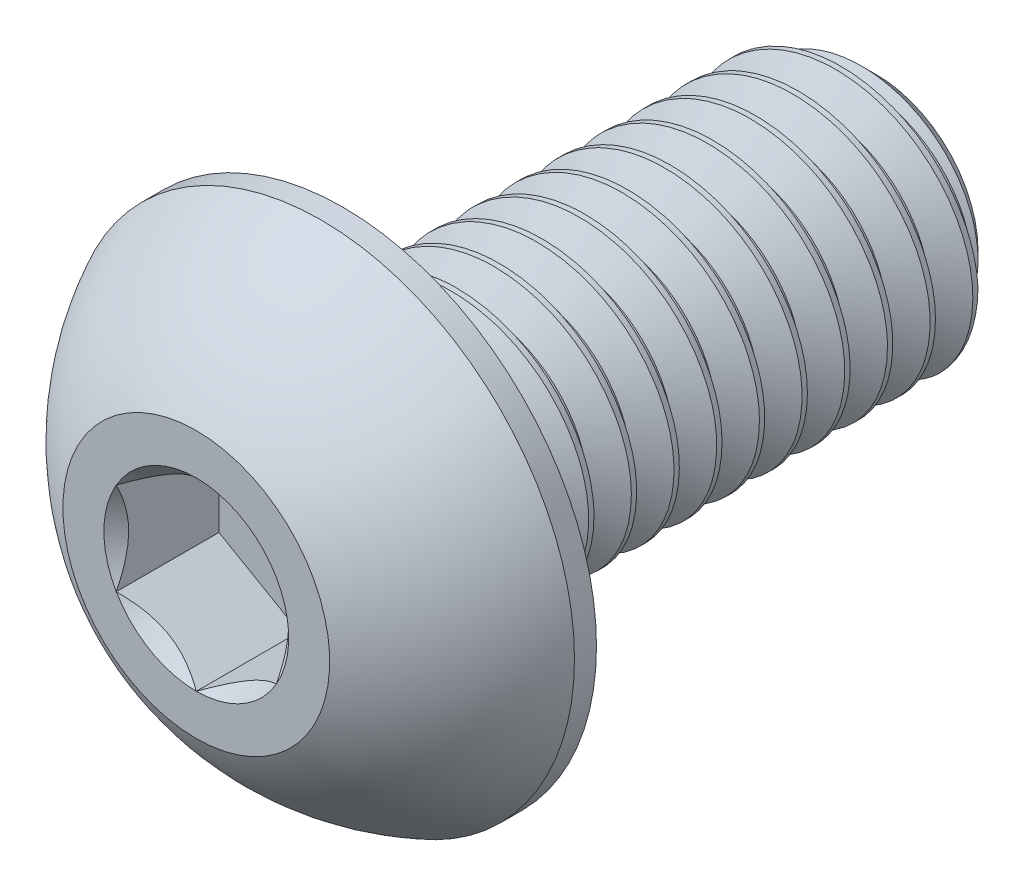
from build123d import *

# Parameters (mm, degrees)
CUT_EXTRUDE2_DEPTH = 1.925
CUT_SWEEP2_PITCH   = 0.8
CUT_SWEEP2_TO      = 10


with BuildPart() as part:
    # Sketch10 → Revolve3 (revolve)
    with BuildSketch(Plane(origin=(0, 0, 0), x_dir=(0, 0, -1), z_dir=(1, 0, 0)), mode=Mode.PRIVATE) as revolve3_sk:
        Polygon((12.15, 2.5), (12.75, 1.9), (12.75, 0), (2.75, 0), (2.75, 2.5), align=None)
    revolve(revolve3_sk.sketch.rotate(Axis((0, 0, 0), (0, 0, -1)), 90), axis=Axis((0, 0, 0), (0, 0, -1)))

    # Sketch7 → Revolve2 (revolve)
    with BuildSketch(Plane(origin=(0, 0, 0), x_dir=(0, 0, -1), z_dir=(1, 0, 0)), mode=Mode.PRIVATE) as revolve2_sk:
        with BuildLine():
            Line((2.3375, 4.75), (2.75, 4.75))
            Line((2.75, 4.75), (2.75, 0))
            Line((2.75, 0), (0, 0))
            Line((0, 0), (0, 2.5))
            ThreePointArc((0, 2.5), (0.991875183, 3.808753282), (2.3375, 4.75))
        make_face()
    revolve(revolve2_sk.sketch.rotate(Axis((0, 0, 0), (0, 0, -1)), 180), axis=Axis((0, 0, 0), (0, 0, -1)))

    # Sketch5 → Cut-Extrude2 (cut)
    with BuildSketch(Plane.XY):
        Polygon((1.5, -0.866025404), (1.5, 0.866025404), (0, 1.732050808), (-1.5, 0.866025404), (-1.5, -0.866025404), (0, -1.732050808), align=None)
    extrude(amount=-CUT_EXTRUDE2_DEPTH, mode=Mode.SUBTRACT)

    # Cut-Extrude3 cone 1 section (through the dimple's axis) → Cut-Extrude3 (revolve, cut)
    with BuildSketch(Plane(origin=(0, 0, 0), x_dir=(0, -1, 0), z_dir=(1, 0, 0))):
        Polygon((0, 0), (1.732050808, 0), (0, 1.732050808), align=None)
    revolve(axis=Axis((0, 0, 0), (0, 0, -1)), mode=Mode.SUBTRACT)


with BuildPart() as body_2:
    # Split1: read off the stored shape, not the designer's step
    # Split1: the piece on the far side of the plane
    add(part.part)
    split(bisect_by=Plane.XY.offset(-2.75), keep=Keep.BOTTOM)

    # Cut-Sweep2: arcs per turn and ends read off the stored shape
    # Cut-Sweep2: the profile of Sketch12 screwed along a right-hand helix through 17 turns, 8 arcs to a turn; built about Z, then put on its axis
    cut_sweep2_z = Axis((0, 0, 0), (0, 0, 1))
    cut_sweep2_corners = [(1.980384758, 0, -0.3), (1.980384758, 0, -0.4), (2.54330127, 0, -0.725), (2.54330127, 0, 0.025)]
    with BuildLine(mode=Mode.PRIVATE) as cut_sweep2_profile:
        Line(cut_sweep2_corners[0], cut_sweep2_corners[1])
        Line(cut_sweep2_corners[1], cut_sweep2_corners[2])
        Line(cut_sweep2_corners[2], cut_sweep2_corners[3])
        Line(cut_sweep2_corners[3], cut_sweep2_corners[0])
    cut_sweep2_cap = Face(cut_sweep2_profile.wire())
    cut_sweep2_turn_angles = [0, 22.5, 45, 67.5, 90, 112.5, 135, 157.5, 180, 202.5, 225, 247.5, 270, 292.5, 315, 337.5, 360]
    cut_sweep2_turn_weights = [1, 0.9238795325112867, 1, 0.9238795325112867, 1, 0.9238795325112867, 1, 0.9238795325112867, 1, 0.9238795325112867, 1, 0.9238795325112867, 1, 0.9238795325112867, 1, 0.9238795325112867, 1]
    cut_sweep2_turn_rails = [Edge.make_bspline([Vector(p[0], p[1], 0).rotate(cut_sweep2_z, cut_sweep2_turn_angles[k]) / cut_sweep2_turn_weights[k] + Vector(0, 0, p[2] + CUT_SWEEP2_PITCH * cut_sweep2_turn_angles[k] / 360) for k in range(17)], [0, 0, 0, 1, 1, 2, 2, 3, 3, 4, 4, 5, 5, 6, 6, 7, 7, 8, 8, 8], 2, cut_sweep2_turn_weights) for p in cut_sweep2_corners]
    cut_sweep2_turn_sides = [Face.make_surface_from_curves(cut_sweep2_turn_rails[p[0]], cut_sweep2_turn_rails[p[1]]) for p in [(0, 1), (1, 2), (2, 3), (3, 0)]]
    cut_sweep2 = Plane(origin=(0, 0, -12.75), x_dir=(0, 1, 0), z_dir=(0, 0, 1)) * split(Solid(Shell([*[p.moved(Location((0, 0, CUT_SWEEP2_PITCH * i))) for i in range(17) for p in cut_sweep2_turn_sides], cut_sweep2_cap, cut_sweep2_cap.rotate(cut_sweep2_z, 6120).moved(Location((0, 0, CUT_SWEEP2_PITCH * 6120 / 360)))])), bisect_by=Plane.XY.offset(CUT_SWEEP2_TO), keep=Keep.BOTTOM, mode=Mode.PRIVATE)
    add(cut_sweep2, mode=Mode.SUBTRACT)


with BuildPart() as part_1:
    add(part.part)

    # Split1
    split(bisect_by=Plane.XY.offset(-2.75), keep=Keep.TOP)

    add(body_2.part)  # Boss-Extrude1 merges body 2
    # Boss-Extrude1: read off the stored shape, not the designer's step
    # Boss-Extrude1 outline → Boss-Extrude1 (revolve)
    with BuildSketch(Plane.XZ):
        Polygon((1.980384758, -2.75), (1.980384758, -3.269615242), (2.5, -2.75), align=None)
    revolve(axis=Axis((0, 0, 0), (0, 0, 1)))


solid = part_1.part
